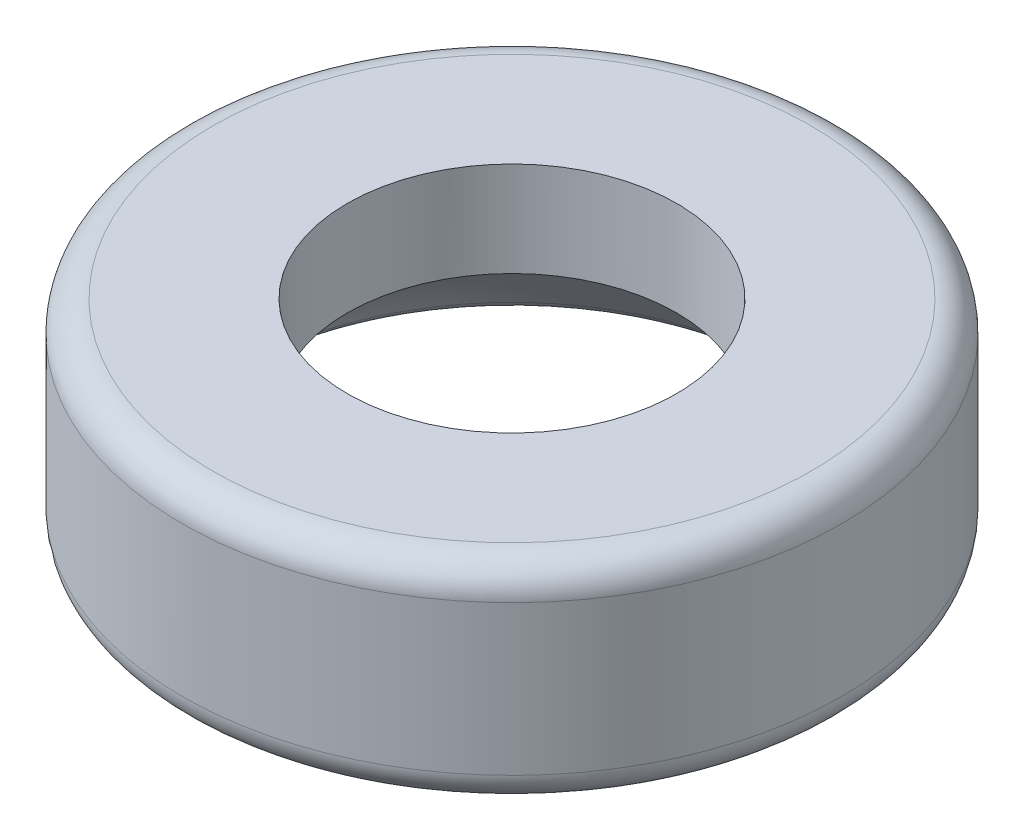
from build123d import *

# Parameters (mm, degrees)
SKETCH2_R          = 2.06375
CUT_EXTRUDE1_DEPTH = 7.404538696


with BuildPart() as part:
    # Sketch1 → Revolve1 (revolve)
    with BuildSketch(Plane.XY):
        with BuildLine():
            Line((4.1275, 0), (4.1275, 4.7625))
            Line((4.1275, 4.7625), (0, 4.7625))
            Line((0, 4.7625), (0, 4.1275))
            ThreePointArc((0, 4.1275), (2.918583239, 2.918583239), (4.1275, 0))
        make_face()
    revolve(axis=Axis((0, -74.223969944, 0), (0, 1, 0)))

    # Fillet1: read off the stored shape, not the designer's step
    # Fillet1 outline → Fillet1 (revolve, cut)
    with BuildSketch(Plane.XY):
        with BuildLine():
            Line((3.429894366, 2.127048943), (3.7465, 2.127049042))
            ThreePointArc((3.7465, 2.127049042), (3.567044036, 2.17195894), (3.429894366, 2.296101236))
            Line((3.429894366, 2.296101236), (3.429894366, 2.127048943))
        make_face()
        with BuildLine():
            Line((3.7465, 2.127049042), (4.1275, 2.127048943))
            Line((4.1275, 2.127048943), (4.1275, 2.508049043))
            ThreePointArc((4.1275, 2.508049043), (4.015907684, 2.238641359), (3.7465, 2.127049042))
        make_face()
        with BuildLine():
            ThreePointArc((3.7465, 4.7625), (4.015907684, 4.650907684), (4.1275, 4.3815))
            Line((4.1275, 4.3815), (4.1275, 4.7625))
            Line((4.1275, 4.7625), (3.7465, 4.7625))
        make_face()
    revolve(axis=Axis((0, 0, 0), (0, 1, 0)), mode=Mode.SUBTRACT)

    # Fillet1 2 outline → Fillet1 2 (revolve, cut)
    with BuildSketch(Plane.XY):
        with BuildLine():
            ThreePointArc((3.53721911, 2.127048947), (3.977192988, 1.103717438), (4.1275, -4e-09))
            Line((4.1275, -4e-09), (4.1275, 2.127048943))
            Line((4.1275, 2.127048943), (3.7465, 2.127049042))
            Line((3.7465, 2.127049042), (3.53721911, 2.127048947))
        make_face()
    revolve(axis=Axis((0, 0, 0), (0, 1, 0)), mode=Mode.SUBTRACT)

    # Sketch2 → Cut-Extrude1 (cut, through all)
    with BuildSketch(Plane(origin=(0, 4.7625, 0), x_dir=(1, 0, 0), z_dir=(0, 1, 0))):
        with Locations(Location((0, 0, 0), (0, 0, 180))):
            Circle(SKETCH2_R)
    extrude(amount=-CUT_EXTRUDE1_DEPTH, mode=Mode.SUBTRACT)


solid = part.part
